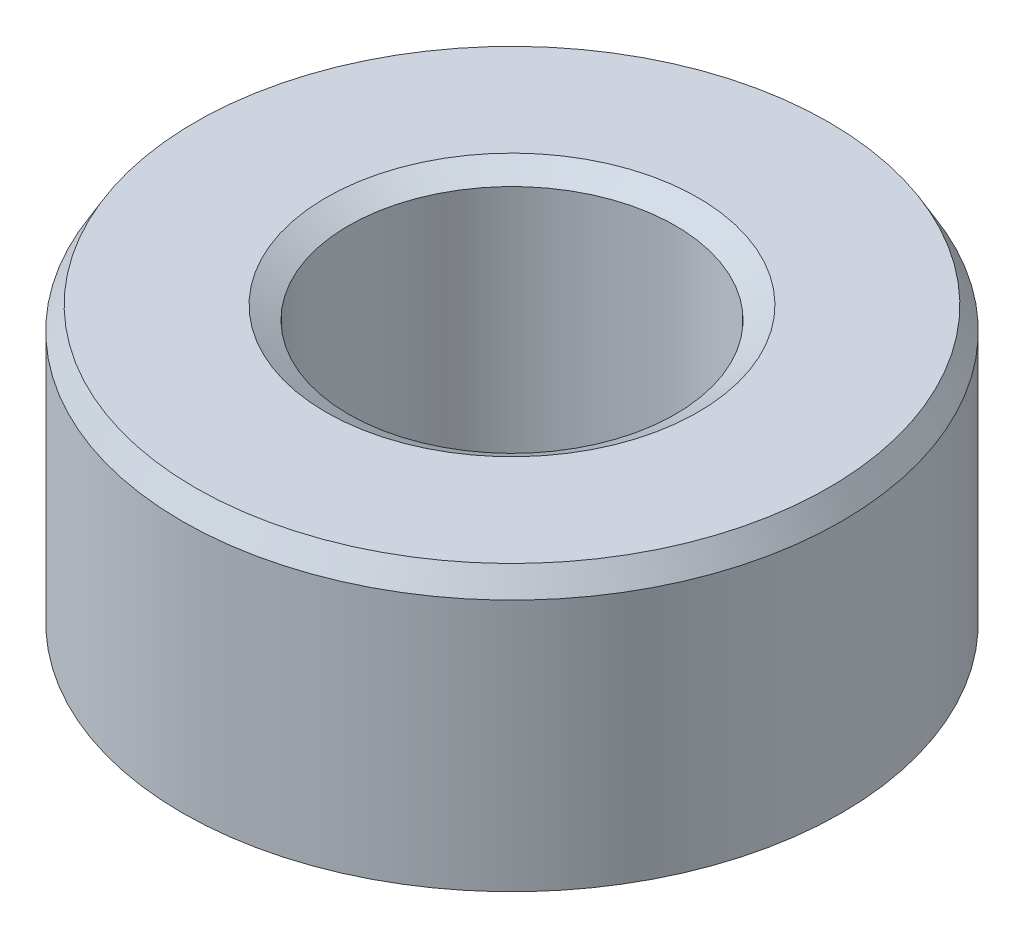
from build123d import *
from OCP.BRepFilletAPI import BRepFilletAPI_MakeChamfer

# Parameters (mm, degrees)
SKETCH1_R           = 55
BOSS_EXTRUDE1_DEPTH = 48.060178029
SKETCH2_R           = 27.259050378
CUT_EXTRUDE1_DEPTH  = 92.431836425
CHAMFER1_SIZE       = 3.760997548
CHAMFER1_SIZE2      = 2.171412947


with BuildPart() as part:
    # Sketch1 → Boss-Extrude1 (new body)
    with BuildSketch(Plane(origin=(0, 0, 0), x_dir=(1, 0, 0), z_dir=(0, 1, 0))):
        Circle(SKETCH1_R)
    extrude(amount=BOSS_EXTRUDE1_DEPTH)

    # Sketch2 → Cut-Extrude1 (cut, through all)
    with BuildSketch(Plane(origin=(0, 0, 0), x_dir=(1, 0, 0), z_dir=(0, 1, 0))):
        Circle(SKETCH2_R)
    extrude(amount=CUT_EXTRUDE1_DEPTH, mode=Mode.SUBTRACT)

    # Chamfer1: one chamfer whose edges measure the first distance from different faces: ONE call of the kernel's chamfer builder (chamfer() names one face for all edges)
    chamfer1_edges_1 = [part.edges().sort_by_distance(p)[0] for p in [
        (-27.259050378, 48.060178029, 0),
    ]]
    chamfer1_side_1 = [part.faces().sort_by_distance(p)[0] for p in [
        (-53.444365081, 48.060178029, 0),
    ]]
    chamfer1_edges_2 = [part.edges().sort_by_distance(p)[0] for p in [
        (-27.259050378, 0, 0),
    ]]
    chamfer1_side_2 = [part.faces().sort_by_distance(p)[0] for p in [
        (-27.259050378, 24.030089014, 0),
    ]]
    chamfer1_edges_3 = [part.edges().sort_by_distance(p)[0] for p in [
        (-55, 0, 0),
    ]]
    chamfer1_side_3 = [part.faces().sort_by_distance(p)[0] for p in [
        (-53.444365081, 0, 0),
    ]]
    chamfer1_edges_4 = [part.edges().sort_by_distance(p)[0] for p in [
        (-55, 48.060178029, 0),
    ]]
    chamfer1_side_4 = [part.faces().sort_by_distance(p)[0] for p in [
        (-55, 24.030089014, 0),
    ]]
    chamfer1 = BRepFilletAPI_MakeChamfer(part.part.solid().wrapped)
    for e in chamfer1_edges_1:
        chamfer1.Add(CHAMFER1_SIZE, CHAMFER1_SIZE2, e.wrapped, chamfer1_side_1[0].wrapped)  # the first distance lies on this face
    for e in chamfer1_edges_2:
        chamfer1.Add(CHAMFER1_SIZE, CHAMFER1_SIZE2, e.wrapped, chamfer1_side_2[0].wrapped)  # the first distance lies on this face
    for e in chamfer1_edges_3:
        chamfer1.Add(CHAMFER1_SIZE, CHAMFER1_SIZE2, e.wrapped, chamfer1_side_3[0].wrapped)  # the first distance lies on this face
    for e in chamfer1_edges_4:
        chamfer1.Add(CHAMFER1_SIZE, CHAMFER1_SIZE2, e.wrapped, chamfer1_side_4[0].wrapped)  # the first distance lies on this face
    add(Compound.cast(chamfer1.Shape()), mode=Mode.REPLACE)


solid = part.part
